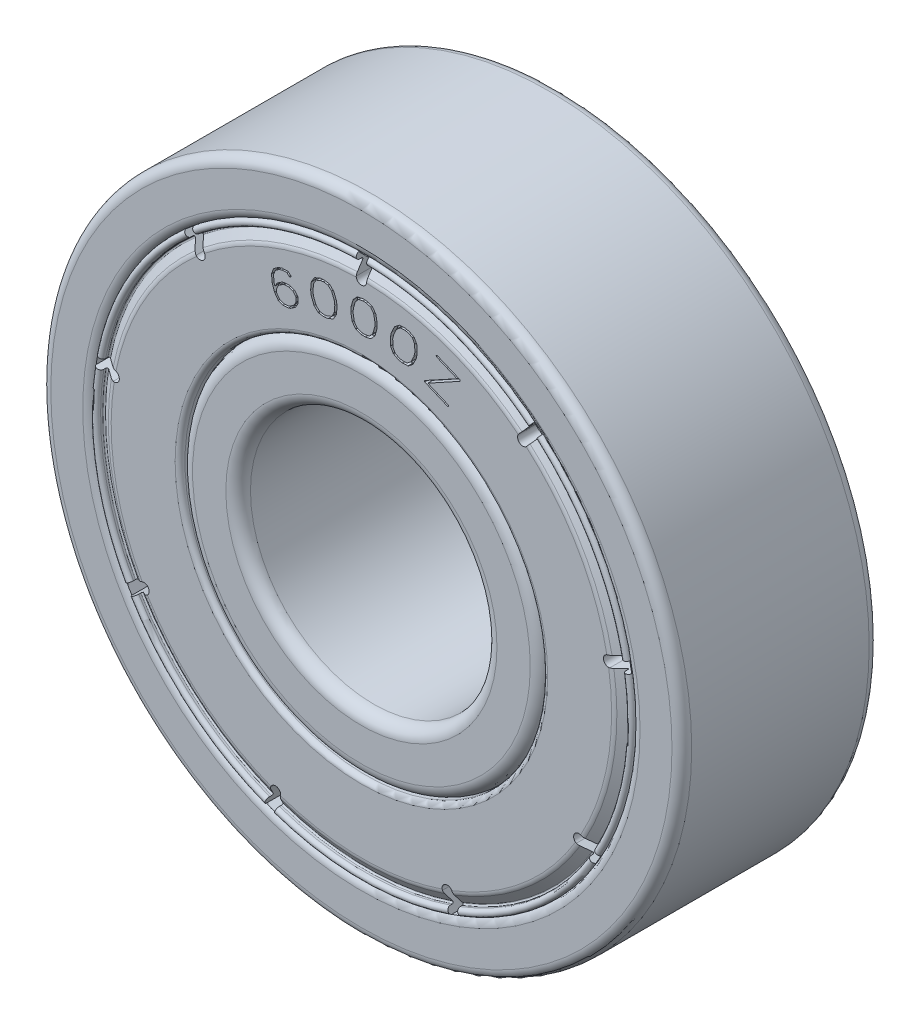
from build123d import *

# Parameters (mm, degrees)
SKETCH1_R         = 13
SKETCH1_R_2       = 11
RINGS_DEPTH       = 8
SKETCH1_R_3       = 7.35
SKETCH1_R_4       = 5
RINGS_2_DEPTH     = 8
FILLET2_R         = 0.5
FILLET6_R         = 0.4
SLOTS_DEPTH       = 21.049937721
CIRPATTERN6_COUNT = 9
MODEL_NO_DEPTH    = 0.2


with BuildPart() as part:
    # Sketch1 → Rings (new body)
    with BuildSketch(Plane.XY):
        Circle(SKETCH1_R)
        Circle(SKETCH1_R_2, mode=Mode.SUBTRACT)
    extrude(amount=-RINGS_DEPTH)


with BuildPart() as body_2:
    # Sketch1 → Rings 2 (new body)
    with BuildSketch(Plane.XY):
        Circle(SKETCH1_R_3)
        Circle(SKETCH1_R_4, mode=Mode.SUBTRACT)
    extrude(amount=-RINGS_2_DEPTH)

    # Fillet2
    fillet2_edges = [body_2.edges().sort_by_distance(p)[0] for p in [
        (-5, 0, 0),
        (-5, 0, -8),
        (-7.35, 0, 0),
        (-7.35, 0, -8),
    ]]
    fillet(fillet2_edges, radius=FILLET2_R)


with BuildPart() as balls_cover_tool:
    # Sketch5 → Balls cover (revolve)
    with BuildSketch(Plane(origin=(0, 0, 0), x_dir=(1, 0, 0), z_dir=(0, 1, 0))):
        with BuildLine():
            Line((7.556692571, 0), (10.150953411, 0))
            ThreePointArc((10.150953411, 0), (10.236762706, 0.012533889), (10.31540184, 0.049088234))
            Line((10.31540184, 0.049088234), (10.642737827, 0.263625359))
            ThreePointArc((10.642737827, 0.263625359), (10.693911383, 0.26579766), (10.720145899, 0.221806731))
            Line((10.720145899, 0.221806731), (10.720145899, 0.140679137))
            ThreePointArc((10.720145899, 0.140679137), (10.860071891, 0.000753144), (10.999997883, 0.140679137))
            Line((10.999997883, 0.140679137), (10.999997883, 4))
            Line((10.999997883, 4), (7.356692571, 4))
            Line((7.356692571, 4), (7.356692571, 0.2))
            ThreePointArc((7.356692571, 0.2), (7.415271215, 0.058578644), (7.556692571, 0))
        make_face()
    balls_cover = revolve(axis=Axis((0, 0, 0), (0, 0, -1)))


with BuildPart() as part_1:
    add(part.part)


with BuildPart() as part_2:
    # Balls cover: joined with balls_cover_tool
    add(part_1.part.fuse(balls_cover_tool.part, tol=0.00001))

    # Fillet6
    # the kernel refuses this fillet: 0.4 mm, written as the material it takes off along each edge
    with BuildSketch(Plane(origin=(0, 0, 0), x_dir=(1, 0, 0), z_dir=(0, -1, 0))) as fillet6_piece_1:
        with BuildLine():
            CenterArc((13 - FILLET6_R, -FILLET6_R), FILLET6_R, 0, 90)
            Line((13 - FILLET6_R, 0), (13, 0))
            Line((13, 0), (13, -FILLET6_R))
        make_face()
    revolve(axis=Axis((0, 0, 0), (0, 0, 1)), mode=Mode.SUBTRACT)
    with BuildSketch(Plane(origin=(0, 0, -8), x_dir=(1, 0, 0), z_dir=(0, -1, 0))) as fillet6_piece_2:
        with BuildLine():
            CenterArc((13 - FILLET6_R, FILLET6_R), FILLET6_R, 270, 90)
            Line((13 - FILLET6_R, 0), (13, 0))
            Line((13, 0), (13, FILLET6_R))
        make_face()
    revolve(axis=Axis((0, 0, -8), (0, 0, 1)), mode=Mode.SUBTRACT)
    with BuildSketch(Plane(origin=(0, 0, -8), x_dir=(1, 0, 0), z_dir=(0, -1, 0))) as fillet6_piece_3:
        with BuildLine():
            CenterArc((11 + FILLET6_R, FILLET6_R), FILLET6_R, 180, 90)
            Line((11, FILLET6_R), (11, 0))
            Line((11, 0), (11 + FILLET6_R, 0))
        make_face()
    revolve(axis=Axis((0, 0, -8), (0, 0, 1)), mode=Mode.SUBTRACT)
    with BuildSketch(Plane(origin=(0, 0, 0), x_dir=(1, 0, 0), z_dir=(0, -1, 0))) as fillet6_piece_4:
        with BuildLine():
            CenterArc((11.304551146, -0.4), FILLET6_R, 90, 49.586286105)
            ThreePointArc((10.999997883, -0.140679137), (11, -0.070339568), (11, 0))
            Line((11, 0), (11.304551146, 0))
        make_face()
    revolve(axis=Axis((0, 0, 0), (0, 0, 1)), mode=Mode.SUBTRACT)

    # Mirror12: Balls cover across plane
    add(balls_cover.mirror(Plane.XY.offset(-4)))

    # Sketch12 → Slots (cut, through all)
    with BuildSketch(Plane.XY):
        with BuildLine():
            Line((0.211738194, 10.993483959), (0.211738194, 10.186631979))
            ThreePointArc((0.211738194, 10.186631979), (0, 9.974893785), (-0.211738194, 10.186631979))
            Line((-0.211738194, 10.186631979), (-0.211738194, 10.993483959))
            Line((-0.211738194, 10.993483959), (0.211738194, 10.993483959))
        make_face()
    slots = extrude(amount=-SLOTS_DEPTH, mode=Mode.SUBTRACT)

    # CirPattern6: Slots ×9 about axis
    cirpattern6_axis = Axis((0, 0, 0), (0, 0, 1))
    for i in range(1, CIRPATTERN6_COUNT):
        add(slots.rotate(cirpattern6_axis, i * 360 / CIRPATTERN6_COUNT), mode=Mode.SUBTRACT)

    # Sketch18 → Model No (cut)
    # profile 1 of 5: a face of its own
    with BuildSketch(Plane.XY):
        with BuildLine():
            add(Edge.make_bspline(
                [(-3.216086124, 8.961683951), (-3.209592271, 8.962175335), (-3.19580699, 8.963218455), (-3.173916371, 8.964652673), (-3.149692987, 8.966029524), (-3.123153071, 8.967712002), (-3.094307405, 8.969790822), (-3.063096365, 8.971282145), (-3.029584621, 8.973270707), (-3.006494899, 8.974670506), (-2.99454821, 8.975394766)],
                knots=[0, 0, 0, 0, 0.704152574, 1.494789111, 2.371951255, 3.32752409, 4.370172141, 5.49883847, 6.705891726, 8, 8, 8, 8], degree=3))
            add(Edge.make_bspline(
                [(-2.99454821, 8.975394766), (-2.989418053, 8.974937731), (-2.979062235, 8.974015151), (-2.97064991, 8.967897841), (-2.966404957, 8.964810979)],
                knots=[0, 0, 0, 0, 0.990777777, 2, 2, 2, 2], degree=3))
            add(Edge.make_bspline(
                [(-2.966404957, 8.964810979), (-2.963502789, 8.962018848), (-2.958475299, 8.957181979), (-2.952277493, 8.950885008), (-2.948239123, 8.946942965), (-2.946670087, 8.944774725), (-2.946199545, 8.944124485)],
                knots=[0, 0, 0, 0, 1.669140501, 2.891488366, 3.667565206, 4, 4, 4, 4], degree=3))
            Line((-2.946199545, 8.944124485), (-2.862491408, 8.875570408))
            add(Edge.make_bspline(
                [(-2.862491408, 8.875570408), (-2.861079803, 8.871585869), (-2.85857134, 8.86450523), (-2.856880666, 8.854914206), (-2.85562591, 8.847521334), (-2.857074877, 8.843723068), (-2.857680595, 8.842135261)],
                knots=[0, 0, 0, 0, 1.466011893, 2.605145193, 3.416902564, 4, 4, 4, 4], degree=3))
            add(Edge.make_bspline(
                [(-2.857680595, 8.842135261), (-2.859043798, 8.839067785), (-2.861776099, 8.832919562), (-2.868891072, 8.825392653), (-2.877883418, 8.819118228), (-2.884942869, 8.816403147), (-2.888710336, 8.814954171)],
                knots=[0, 0, 0, 0, 0.938077169, 1.88021237, 2.868718114, 4, 4, 4, 4], degree=3))
            add(Edge.make_bspline(
                [(-2.888710336, 8.814954171), (-2.890805511, 8.814607502), (-2.894282697, 8.814032164), (-2.898371928, 8.812797794), (-2.900493885, 8.812612153), (-2.901218448, 8.812548764)],
                knots=[0, 0, 0, 0, 1.498776425, 2.487392719, 3, 3, 3, 3], degree=3))
            add(Edge.make_bspline(
                [(-2.901218448, 8.812548764), (-2.902669602, 8.812665581), (-2.906278231, 8.812956071), (-2.912657048, 8.814979784), (-2.921193292, 8.81773848), (-2.927532468, 8.820280553), (-2.931045485, 8.821689308)],
                knots=[0, 0, 0, 0, 0.556595838, 1.384103523, 2.55033371, 4, 4, 4, 4], degree=3))
            Line((-2.931045485, 8.821689308), (-3.024615788, 8.904916364))
            Line((-3.024615788, 8.904916364), (-3.215845583, 8.894813658))
            Line((-3.215845583, 8.894813658), (-3.34188887, 8.851516345))
            Line((-3.34188887, 8.851516345), (-3.497278112, 8.743513606))
            Line((-3.497278112, 8.743513606), (-3.567034893, 8.550118945))
            Line((-3.567034893, 8.550118945), (-3.536486234, 8.259545872))
            Line((-3.536486234, 8.259545872), (-3.510267306, 8.183775576))
            Line((-3.510267306, 8.183775576), (-3.414051057, 8.339405359))
            add(Edge.make_bspline(
                [(-3.414051057, 8.339405359), (-3.408442144, 8.343179272), (-3.396504761, 8.351211246), (-3.377457028, 8.363856056), (-3.356601215, 8.378430318), (-3.333540292, 8.394118635), (-3.308729751, 8.411618593), (-3.281802588, 8.430284773), (-3.252848688, 8.45055824), (-3.232918632, 8.464639275), (-3.222580721, 8.471943242)],
                knots=[0, 0, 0, 0, 0.696724301, 1.482830083, 2.356130861, 3.318803496, 4.357261693, 5.485081756, 6.695487794, 8, 8, 8, 8], degree=3))
            Line((-3.222580721, 8.471943242), (-3.176637462, 8.487818923))
            add(Edge.make_bspline(
                [(-3.176637462, 8.487818923), (-3.17111417, 8.489689845), (-3.16107389, 8.493090822), (-3.147410715, 8.497319583), (-3.136531539, 8.499800479), (-3.130218461, 8.500679498), (-3.127567175, 8.501048658)],
                knots=[0, 0, 0, 0, 1.374332837, 2.49827251, 3.369323451, 4, 4, 4, 4], degree=3))
            Line((-3.127567175, 8.501048658), (-2.911080614, 8.514759473))
            Line((-2.911080614, 8.514759473), (-2.896648176, 8.512354067))
            Line((-2.896648176, 8.512354067), (-2.721534603, 8.445243233))
            Line((-2.721534603, 8.445243233), (-2.712153518, 8.437305392))
            add(Edge.make_bspline(
                [(-2.712153518, 8.437305392), (-2.701134371, 8.424276705), (-2.67965721, 8.398882794), (-2.647401146, 8.362307633), (-2.616891968, 8.327490947), (-2.596645942, 8.305219942), (-2.586831854, 8.294424262)],
                knots=[0, 0, 0, 0, 1.077305936, 2.099751757, 3.078870877, 4, 4, 4, 4], degree=3))
            Line((-2.586831854, 8.294424262), (-2.571918335, 8.251367491))
            add(Edge.make_bspline(
                [(-2.571918335, 8.251367491), (-2.571035976, 8.247773355), (-2.568902253, 8.239082012), (-2.567625305, 8.223243733), (-2.566595344, 8.20255483), (-2.566891183, 8.176795217), (-2.56720611, 8.146079851), (-2.568761715, 8.110391204), (-2.571295765, 8.069755736), (-2.573118442, 8.040974524), (-2.574083201, 8.025740386)],
                knots=[0, 0, 0, 0, 0.392163384, 0.948329893, 1.680741603, 2.591013955, 3.680070807, 4.940173343, 6.380407955, 8, 8, 8, 8], degree=3))
            add(Edge.make_bspline(
                [(-2.574083201, 8.025740386), (-2.581156733, 8.013036154), (-2.595996878, 7.9863829), (-2.62067551, 7.945138621), (-2.648747122, 7.900838526), (-2.668955318, 7.870471443), (-2.679439994, 7.854716003)],
                knots=[0, 0, 0, 0, 0.868317406, 1.821714436, 2.869833929, 4, 4, 4, 4], degree=3))
            add(Edge.make_bspline(
                [(-2.679439994, 7.854716003), (-2.711487741, 7.831794365), (-2.774233451, 7.786916499), (-2.838181088, 7.743768904), (-2.869467086, 7.722659201)],
                knots=[0, 0, 0, 0, 1.021511971, 2, 2, 2, 2], degree=3))
            Line((-2.869467086, 7.722659201), (-2.950769817, 7.694756489))
            add(Edge.make_bspline(
                [(-2.950769817, 7.694756489), (-2.958064848, 7.694252707), (-2.974092151, 7.693145891), (-3.000410827, 7.691869733), (-3.031187198, 7.689809839), (-3.06494707, 7.687791183), (-3.098704979, 7.685740582), (-3.129401934, 7.683693126), (-3.155720519, 7.682415496), (-3.171747832, 7.681308841), (-3.179042868, 7.680805133)],
                knots=[0, 0, 0, 0, 0.767351992, 1.685884949, 2.765000181, 4.004199168, 5.234999819, 6.314115051, 7.232648008, 8, 8, 8, 8], degree=3))
            add(Edge.make_bspline(
                [(-3.179042868, 7.680805133), (-3.184655871, 7.682808552), (-3.196526998, 7.687045653), (-3.21522219, 7.693744304), (-3.235840522, 7.701249824), (-3.258337704, 7.709679169), (-3.282879302, 7.718802339), (-3.309331258, 7.728684511), (-3.337766584, 7.739211759), (-3.35729094, 7.746693444), (-3.367386176, 7.750561913)],
                knots=[0, 0, 0, 0, 0.712150811, 1.506151675, 2.372997181, 3.334003861, 4.376869492, 5.501594102, 6.708177717, 8, 8, 8, 8], degree=3))
            Line((-3.367386176, 7.750561913), (-3.37676726, 7.758499754))
            Line((-3.37676726, 7.758499754), (-3.520610553, 7.963680905))
            Line((-3.520610553, 7.963680905), (-3.618270046, 8.247518841))
            Line((-3.618270046, 8.247518841), (-3.645932217, 8.546029754))
            Line((-3.645932217, 8.546029754), (-3.643286271, 8.558297326))
            Line((-3.643286271, 8.558297326), (-3.565110568, 8.769732534))
            Line((-3.565110568, 8.769732534), (-3.555970024, 8.782000105))
            add(Edge.make_bspline(
                [(-3.555970024, 8.782000105), (-3.549872608, 8.785923067), (-3.536275669, 8.794671081), (-3.513886945, 8.809279334), (-3.487740699, 8.827228101), (-3.458707624, 8.846903704), (-3.429849895, 8.867032727), (-3.403437816, 8.88490843), (-3.381183491, 8.900194964), (-3.367708252, 8.909408436), (-3.361613201, 8.913575826)],
                knots=[0, 0, 0, 0, 0.741364021, 1.653205527, 2.733325106, 3.984019955, 5.23935492, 6.330864694, 7.245025239, 8, 8, 8, 8], degree=3))
            Line((-3.361613201, 8.913575826), (-3.216086124, 8.961683951))
        make_face()
        Polygon((-2.931045485, 8.436824311), (-3.126605012, 8.425278361), (-3.184815843, 8.405072949), (-3.350307792, 8.292499937), (-3.433053766, 8.15467016), (-3.44243485, 7.986291724), (-3.313264536, 7.806367338), (-3.16436989, 7.752245698), (-2.968569823, 7.763791648), (-2.907953586, 7.782794357), (-2.744385962, 7.894886287), (-2.659715663, 8.033437686), (-2.6510562, 8.203499907), (-2.666931881, 8.249924247), (-2.779023812, 8.380056724), align=None, mode=Mode.SUBTRACT)
    # profile 2 of 5: a face of its own
    with BuildSketch(Plane.XY):
        with BuildLine():
            add(Edge.make_bspline(
                [(-1.53237229, 9.399603211), (-1.52579825, 9.398635864), (-1.511932228, 9.396595528), (-1.489883437, 9.393463367), (-1.465450068, 9.390006535), (-1.438519918, 9.386927018), (-1.409330745, 9.38250421), (-1.377623105, 9.37860468), (-1.34347337, 9.374222115), (-1.319895818, 9.371291277), (-1.307707348, 9.369776173)],
                knots=[0, 0, 0, 0, 0.703641503, 1.48412668, 2.358283273, 3.316626369, 4.35407406, 5.484084266, 6.699391512, 8, 8, 8, 8], degree=3))
            Line((-1.307707348, 9.369776173), (-1.291591126, 9.359673467))
            Line((-1.291591126, 9.359673467), (-1.12706134, 9.20260044))
            Line((-1.12706134, 9.20260044), (-1.121528906, 9.192978815))
            Line((-1.121528906, 9.192978815), (-1.011601841, 8.911305746))
            Line((-1.011601841, 8.911305746), (-0.985863994, 8.730900278))
            Line((-0.985863994, 8.730900278), (-1.013045084, 8.429983959))
            Line((-1.013045084, 8.429983959), (-1.019299141, 8.416754224))
            Line((-1.019299141, 8.416754224), (-1.136201884, 8.223119023))
            Line((-1.136201884, 8.223119023), (-1.145582968, 8.214700101))
            add(Edge.make_bspline(
                [(-1.145582968, 8.214700101), (-1.152252535, 8.212089768), (-1.1671189, 8.206271375), (-1.191158292, 8.195851849), (-1.219482044, 8.183551264), (-1.250334243, 8.169798945), (-1.28112688, 8.155934498), (-1.308810288, 8.143216553), (-1.332307419, 8.132561779), (-1.346513101, 8.126177895), (-1.352928985, 8.123294664)],
                knots=[0, 0, 0, 0, 0.75844149, 1.690554543, 2.774320759, 4.028767399, 5.267714311, 6.350648588, 7.255083497, 8, 8, 8, 8], degree=3))
            Line((-1.352928985, 8.123294664), (-1.512888499, 8.100683846))
            add(Edge.make_bspline(
                [(-1.512888499, 8.100683846), (-1.519542611, 8.101492659), (-1.533650602, 8.103207497), (-1.555960915, 8.105767747), (-1.580569829, 8.108952694), (-1.607513532, 8.112540148), (-1.636758989, 8.116697061), (-1.668371987, 8.120948806), (-1.702186627, 8.125832516), (-1.725524893, 8.129078462), (-1.737553441, 8.130751423)],
                knots=[0, 0, 0, 0, 0.709711498, 1.504724292, 2.377642268, 3.336938557, 4.382645641, 5.505199376, 6.714179062, 8, 8, 8, 8], degree=3))
            Line((-1.737553441, 8.130751423), (-1.753429123, 8.138929805))
            Line((-1.753429123, 8.138929805), (-1.917958909, 8.296243372))
            Line((-1.917958909, 8.296243372), (-1.923491343, 8.305864997))
            Line((-1.923491343, 8.305864997), (-2.033418408, 8.588019148))
            Line((-2.033418408, 8.588019148), (-2.059637336, 8.772032725))
            Line((-2.059637336, 8.772032725), (-2.032456245, 9.071505801))
            Line((-2.032456245, 9.071505801), (-2.027645433, 9.08305175))
            Line((-2.027645433, 9.08305175), (-1.911223771, 9.276686952))
            Line((-1.911223771, 9.276686952), (-1.899918362, 9.287030199))
            add(Edge.make_bspline(
                [(-1.899918362, 9.287030199), (-1.893184514, 9.289759287), (-1.878185029, 9.295838265), (-1.853367358, 9.305810664), (-1.824295933, 9.31851349), (-1.792089901, 9.332421205), (-1.759998057, 9.346853865), (-1.730689348, 9.359401714), (-1.706050495, 9.370355368), (-1.691130893, 9.376916298), (-1.684393964, 9.379878879)],
                knots=[0, 0, 0, 0, 0.743039405, 1.655102498, 2.734980086, 3.987143356, 5.242604373, 6.33326118, 7.247385935, 8, 8, 8, 8], degree=3))
            Line((-1.684393964, 9.379878879), (-1.53237229, 9.399603211))
        make_face()
        Polygon((-1.353650607, 9.29905723), (-1.536942562, 9.32214913), (-1.668277742, 9.303627502), (-1.839783206, 9.228097746), (-1.941050809, 9.056832823), (-1.966307574, 8.778527322), (-1.942012971, 8.607502939), (-1.8373778, 8.342427172), (-1.692091264, 8.204597395), (-1.508318228, 8.179821711), (-1.378907372, 8.198102798), (-1.205958664, 8.275556879), (-1.104691062, 8.446821802), (-1.079434296, 8.727051628), (-1.102766737, 8.891100333), (-1.20836407, 9.161227453), align=None, mode=Mode.SUBTRACT)
    # profile 3 of 5: a face of its own
    with BuildSketch(Plane.XY):
        with BuildLine():
            add(Edge.make_bspline(
                [(0.220615769, 9.521222726), (0.226867803, 9.519051995), (0.240162055, 9.514436179), (0.261332427, 9.507227306), (0.284841912, 9.499338885), (0.310643231, 9.490629568), (0.338790922, 9.481261409), (0.369338086, 9.471153952), (0.402227148, 9.460375705), (0.424915697, 9.452911497), (0.436621248, 9.449060539)],
                knots=[0, 0, 0, 0, 0.697432318, 1.483012019, 2.356752903, 3.310652782, 4.352724192, 5.482974033, 6.701407709, 8, 8, 8, 8], degree=3))
            Line((0.436621248, 9.449060539), (0.450813145, 9.436071345))
            Line((0.450813145, 9.436071345), (0.583110488, 9.250133443))
            Line((0.583110488, 9.250133443), (0.586959138, 9.239549656))
            Line((0.586959138, 9.239549656), (0.64204294, 8.941279283))
            Line((0.64204294, 8.941279283), (0.633142937, 8.75870895))
            Line((0.633142937, 8.75870895), (0.54919426, 8.467414256))
            Line((0.54919426, 8.467414256), (0.540053716, 8.455627765))
            Line((0.540053716, 8.455627765), (0.388272583, 8.287008788))
            Line((0.388272583, 8.287008788), (0.377207714, 8.280514192))
            add(Edge.make_bspline(
                [(0.377207714, 8.280514192), (0.370067993, 8.279170028), (0.354320624, 8.27620534), (0.328491101, 8.27087191), (0.2982584, 8.264142367), (0.265191634, 8.256237492), (0.232259784, 8.248366174), (0.202402192, 8.241440487), (0.177211617, 8.235482467), (0.162001132, 8.231696365), (0.155188719, 8.230000661)],
                knots=[0, 0, 0, 0, 0.76568038, 1.688784651, 2.779505058, 4.029817807, 5.271907836, 6.348029064, 7.260121602, 8, 8, 8, 8], degree=3))
            Line((0.155188719, 8.230000661), (-0.007176202, 8.237938501))
            add(Edge.make_bspline(
                [(-0.007176202, 8.237938501), (-0.013595987, 8.239926098), (-0.027185438, 8.24413346), (-0.048653304, 8.251176475), (-0.072361291, 8.259110248), (-0.098337032, 8.267777594), (-0.12652878, 8.277095117), (-0.156780496, 8.287525143), (-0.189373219, 8.298554355), (-0.211800878, 8.306318224), (-0.223422222, 8.310341229)],
                knots=[0, 0, 0, 0, 0.707240275, 1.497091771, 2.377649351, 3.338257621, 4.378916579, 5.502323105, 6.705778422, 8, 8, 8, 8], degree=3))
            Line((-0.223422222, 8.310341229), (-0.237614119, 8.321406097))
            Line((-0.237614119, 8.321406097), (-0.369911461, 8.50758454))
            Line((-0.369911461, 8.50758454), (-0.373760111, 8.518168327))
            Line((-0.373760111, 8.518168327), (-0.428843914, 8.816679241))
            Line((-0.428843914, 8.816679241), (-0.41970337, 9.003098223))
            Line((-0.41970337, 9.003098223), (-0.335754693, 9.293190215))
            Line((-0.335754693, 9.293190215), (-0.329019555, 9.303292921))
            Line((-0.329019555, 9.303292921), (-0.176997881, 9.472152439))
            Line((-0.176997881, 9.472152439), (-0.164008688, 9.480090279))
            add(Edge.make_bspline(
                [(-0.164008688, 9.480090279), (-0.15678642, 9.481422724), (-0.14070274, 9.484390023), (-0.114358396, 9.490028025), (-0.083178564, 9.496808089), (-0.048762209, 9.504341878), (-0.014295205, 9.512168386), (0.016946082, 9.519430528), (0.043403151, 9.525456095), (0.059452055, 9.529006898), (0.06666977, 9.53060381)],
                knots=[0, 0, 0, 0, 0.746327344, 1.662038992, 2.737663403, 3.989158124, 5.242428899, 6.329565851, 7.248751324, 8, 8, 8, 8], degree=3))
            Line((0.06666977, 9.53060381), (0.220615769, 9.521222726))
        make_face()
        Polygon((0.378650958, 9.388925383), (0.201372519, 9.446895673), (0.067631932, 9.45339027), (-0.116622185, 9.411536202), (-0.24964115, 9.261919934), (-0.327576312, 8.992033355), (-0.336235774, 8.818603566), (-0.282835756, 8.537411577), (-0.165211391, 8.373603413), (0.011826508, 8.314189879), (0.143402229, 8.307695282), (0.330061752, 8.351233135), (0.463080717, 8.500849402), (0.541256419, 8.772419766), (0.5494348, 8.938633336), (0.496275323, 9.2255983), align=None, mode=Mode.SUBTRACT)
    # profile 4 of 5: a face of its own
    with BuildSketch(Plane.XY):
        with BuildLine():
            add(Edge.make_bspline(
                [(1.937137511, 9.315705992), (1.94298106, 9.312481026), (1.955419363, 9.305616514), (1.975349376, 9.295114435), (1.997532884, 9.28359149), (2.021818321, 9.270825001), (2.048284168, 9.256885672), (2.076851658, 9.241704146), (2.10769716, 9.225540432), (2.129079978, 9.214581441), (2.140153797, 9.208905955)],
                knots=[0, 0, 0, 0, 0.698266673, 1.486297833, 2.35676733, 3.313575074, 4.356725535, 5.486222155, 6.698154762, 8, 8, 8, 8], degree=3))
            Line((2.140153797, 9.208905955), (2.151940288, 9.193992436))
            Line((2.151940288, 9.193992436), (2.25320789, 8.99073561))
            Line((2.25320789, 8.99073561), (2.255132215, 8.979670741))
            Line((2.255132215, 8.979670741), (2.261145731, 8.680438206))
            Line((2.261145731, 8.680438206), (2.222659231, 8.50460301))
            Line((2.222659231, 8.50460301), (2.091564591, 8.235197513))
            Line((2.091564591, 8.235197513), (2.080740263, 8.225335347))
            Line((2.080740263, 8.225335347), (1.90201858, 8.087024489))
            Line((1.90201858, 8.087024489), (1.89023209, 8.082454217))
            add(Edge.make_bspline(
                [(1.89023209, 8.082454217), (1.882935946, 8.082291381), (1.866819137, 8.081931685), (1.840260542, 8.081398787), (1.809094441, 8.079383999), (1.774841078, 8.077772785), (1.740786887, 8.075453399), (1.709974253, 8.074008289), (1.684016423, 8.072142189), (1.6682944, 8.071290538), (1.661237417, 8.070908267)],
                knots=[0, 0, 0, 0, 0.763848268, 1.687301661, 2.779830429, 4.032026081, 5.276323146, 6.352092751, 7.260320807, 8, 8, 8, 8], degree=3))
            Line((1.661237417, 8.070908267), (1.501277902, 8.106027198))
            add(Edge.make_bspline(
                [(1.501277902, 8.106027198), (1.495177645, 8.10906107), (1.482302586, 8.115464288), (1.462116114, 8.125846314), (1.439855685, 8.137378323), (1.41576985, 8.15052301), (1.389091967, 8.164058665), (1.360617292, 8.179266222), (1.330052543, 8.195593088), (1.309079789, 8.206962606), (1.298261616, 8.212827235)],
                knots=[0, 0, 0, 0, 0.712761049, 1.504336508, 2.374784611, 3.335495291, 4.374734211, 5.504203071, 6.712617222, 8, 8, 8, 8], degree=3))
            Line((1.298261616, 8.212827235), (1.285994044, 8.226056969))
            Line((1.285994044, 8.226056969), (1.184726442, 8.429554336))
            Line((1.184726442, 8.429554336), (1.183042658, 8.440378664))
            Line((1.183042658, 8.440378664), (1.177029142, 8.740332821))
            Line((1.177029142, 8.740332821), (1.216477804, 8.919776126))
            Line((1.216477804, 8.919776126), (1.347331903, 9.18773838))
            Line((1.347331903, 9.18773838), (1.355750825, 9.196638383))
            Line((1.355750825, 9.196638383), (1.534231968, 9.334949242))
            Line((1.534231968, 9.334949242), (1.548423864, 9.340481676))
            add(Edge.make_bspline(
                [(1.548423864, 9.340481676), (1.555801129, 9.340618069), (1.572243131, 9.340922053), (1.599338271, 9.342012246), (1.631416848, 9.343127171), (1.666855481, 9.344783624), (1.702371233, 9.346627211), (1.734595388, 9.34840239), (1.761863316, 9.349549183), (1.778380771, 9.350262404), (1.785837459, 9.350584382)],
                knots=[0, 0, 0, 0, 0.745167284, 1.660784016, 2.738543056, 3.986881266, 5.243700273, 6.330275795, 7.246214745, 8, 8, 8, 8], degree=3))
            Line((1.785837459, 9.350584382), (1.937137511, 9.315705992))
        make_face()
        Polygon((2.071359179, 9.158151884), (1.905145608, 9.243784345), (1.773810428, 9.27264922), (1.584745498, 9.263268136), (1.428634634, 9.140592418), (1.30740216, 8.892835576), (1.270839985, 8.726622006), (1.277815663, 8.445430017), (1.367777856, 8.266948875), (1.533510346, 8.179632629), (1.662921201, 8.151248835), (1.854391537, 8.161832622), (2.010502401, 8.2842678), (2.132215957, 8.533708426), (2.167334888, 8.6934274), (2.161321372, 8.979670741), align=None, mode=Mode.SUBTRACT)
    # profile 5 of 5: a face of its own
    with BuildSketch(Plane.XY):
        with BuildLine():
            add(Edge.make_bspline(
                [(4.006859897, 8.635150729), (4.008409313, 8.630259186), (4.011610515, 8.620152919), (4.008318171, 8.610053699), (4.006619357, 8.60484261)],
                knots=[0, 0, 0, 0, 0.968021718, 2, 2, 2, 2], degree=3))
            add(Edge.make_bspline(
                [(4.006619357, 8.60484261), (4.005539602, 8.602737736), (4.003254066, 8.59828231), (3.999315921, 8.595175999), (3.997238272, 8.593537201)],
                knots=[0, 0, 0, 0, 0.944859029, 2, 2, 2, 2], degree=3))
            Line((3.997238272, 8.593537201), (2.695191879, 7.876485603))
            Line((2.695191879, 7.876485603), (3.516157026, 7.529626025))
            add(Edge.make_bspline(
                [(3.516157026, 7.529626025), (3.519291933, 7.527246192), (3.525103283, 7.522834564), (3.532110415, 7.514972412), (3.535903133, 7.506045572), (3.536211745, 7.499908966), (3.536362438, 7.4969125)],
                knots=[0, 0, 0, 0, 1.17374975, 2.175844832, 3.109276605, 4, 4, 4, 4], degree=3))
            add(Edge.make_bspline(
                [(3.536362438, 7.4969125), (3.536362839, 7.495373816), (3.536363839, 7.491533489), (3.534858959, 7.48797835), (3.533957032, 7.485847631)],
                knots=[0, 0, 0, 0, 0.801330011, 2, 2, 2, 2], degree=3))
            add(Edge.make_bspline(
                [(3.533957032, 7.485847631), (3.531715105, 7.481587263), (3.52746197, 7.473504967), (3.516033624, 7.465588118), (3.501974999, 7.463924481), (3.493072441, 7.467067969), (3.488254314, 7.468769247)],
                knots=[0, 0, 0, 0, 1.036274726, 1.965904596, 2.899133257, 4, 4, 4, 4], degree=3))
            Line((3.488254314, 7.468769247), (2.578048596, 7.853393704))
            add(Edge.make_bspline(
                [(2.578048596, 7.853393704), (2.575494778, 7.855083355), (2.570261557, 7.858545747), (2.565030266, 7.866957492), (2.561784487, 7.877289401), (2.561568582, 7.884873614), (2.561451293, 7.888993716)],
                knots=[0, 0, 0, 0, 0.881006855, 1.805337888, 2.807756305, 4, 4, 4, 4], degree=3))
            add(Edge.make_bspline(
                [(2.561451293, 7.888993716), (2.56430625, 7.894967623), (2.569756897, 7.906372932), (2.579936184, 7.913827512), (2.584783733, 7.917377509)],
                knots=[0, 0, 0, 0, 1.04756599, 2, 2, 2, 2], degree=3))
            Line((2.584783733, 7.917377509), (3.881778773, 8.625048023))
            Line((3.881778773, 8.625048023), (3.882259855, 8.626731807))
            Line((3.882259855, 8.626731807), (3.056724436, 8.975515711))
            add(Edge.make_bspline(
                [(3.056724436, 8.975515711), (3.053380506, 8.977596248), (3.04722113, 8.98142851), (3.040461312, 8.989235992), (3.036120467, 8.997710212), (3.035904743, 9.003770482), (3.035797402, 9.006785992)],
                knots=[0, 0, 0, 0, 1.185620414, 2.183862545, 3.096314259, 4, 4, 4, 4], degree=3))
            add(Edge.make_bspline(
                [(3.035797402, 9.006785992), (3.035878588, 9.008487312), (3.03608637, 9.012841524), (3.037849939, 9.016851155), (3.03892443, 9.019294104)],
                knots=[0, 0, 0, 0, 0.781459355, 2, 2, 2, 2], degree=3))
            add(Edge.make_bspline(
                [(3.03892443, 9.019294104), (3.04101052, 9.023257514), (3.045025284, 9.030885256), (3.056626449, 9.037896581), (3.071133059, 9.039664784), (3.080621392, 9.035986315), (3.085829851, 9.033967082)],
                knots=[0, 0, 0, 0, 0.951752743, 1.83168639, 2.809741185, 4, 4, 4, 4], degree=3))
            Line((3.085829851, 9.033967082), (3.973665291, 8.660648035))
            add(Edge.make_bspline(
                [(3.973665291, 8.660648035), (3.977821832, 8.658845199), (3.985496483, 8.655516435), (3.995142002, 8.64920471), (4.002688512, 8.642804081), (4.005540206, 8.637572002), (4.006859897, 8.635150729)],
                knots=[0, 0, 0, 0, 1.267854214, 2.340970634, 3.232243196, 4, 4, 4, 4], degree=3))
        make_face()
    extrude(amount=-MODEL_NO_DEPTH, mode=Mode.SUBTRACT)


solid = Compound([body_2.part, part_2.part])
